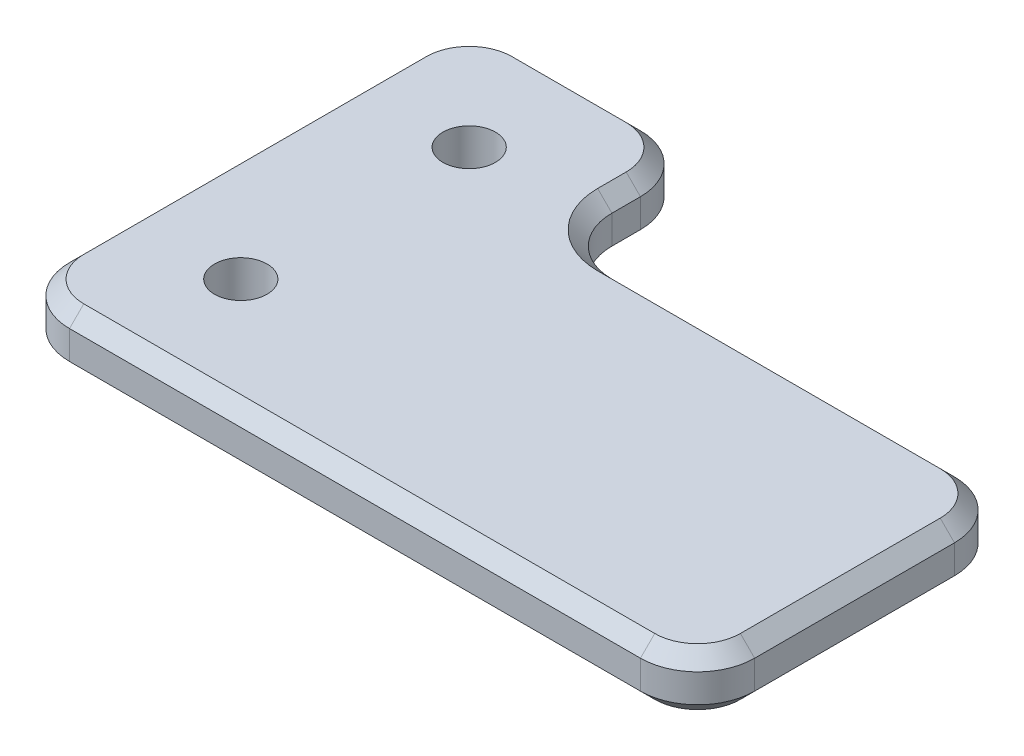
from build123d import *

# Parameters (mm, degrees)
SKETCH1_W           = 76.2
SKETCH1_H           = 6.35
BOSS_EXTRUDE1_DEPTH = 25.4
SKETCH2_R           = 2.921
CUT_EXTRUDE1_DEPTH  = 81.572467382
SKETCH3_W           = 50.8
SKETCH3_H           = 15.875
CUT_EXTRUDE2_DEPTH  = 81.572467382
FILLET1_R           = 6.35
CHAMFER2_SIZE       = 1.5875


with BuildPart() as part:
    # Sketch1 → Boss-Extrude1 (new, symmetric)
    with BuildSketch(Plane.XY):
        with Locations((38.1, 3.175)):
            Rectangle(SKETCH1_W, SKETCH1_H)
    extrude(amount=BOSS_EXTRUDE1_DEPTH, both=True)

    # Sketch2 → Cut-Extrude1 (cut, through all)
    with BuildSketch(Plane(origin=(0, 6.35, 0), x_dir=(1, 0, 0), z_dir=(0, 1, 0))):
        with Locations((12.7, 12.7)):
            Circle(SKETCH2_R)
        with Locations((12.7, -12.7)):
            Circle(SKETCH2_R)
    extrude(amount=-CUT_EXTRUDE1_DEPTH, mode=Mode.SUBTRACT)

    # Sketch3 → Cut-Extrude2 (cut, through all)
    with BuildSketch(Plane(origin=(0, 6.35, 0), x_dir=(1, 0, 0), z_dir=(0, 1, 0))):
        with Locations((50.8, 17.4625)):
            Rectangle(SKETCH3_W, SKETCH3_H)
    extrude(amount=-CUT_EXTRUDE2_DEPTH, mode=Mode.SUBTRACT)

    # Fillet1
    fillet1_edges = [part.edges().sort_by_distance(p)[0] for p in [
        (0, 3.175, 25.4),
        (0, 3.175, -25.4),
        (25.4, 3.175, -25.4),
        (25.4, 3.175, -9.525),
        (76.2, 3.175, 25.4),
        (76.2, 3.175, -9.525),
    ]]
    fillet(fillet1_edges, radius=FILLET1_R)

    # Chamfer2
    chamfer2_edges = [part.edges().sort_by_distance(p)[0] for p in [
        (1.859871939, 0, 23.540128061),
        (38.1, 0, 25.4),
        (74.340128061, 0, 23.540128061),
        (76.2, 0, 7.9375),
        (74.340128061, 0, -7.665128061),
        (50.8, 0, -9.525),
        (27.259871939, 0, -11.384871939),
        (25.4, 0, -17.4625),
        (23.540128061, 0, -23.540128061),
        (12.7, 0, -25.4),
        (0, 0, 0),
        (1.859871939, 0, -23.540128061),
        (1.859871939, 6.35, 23.540128061),
        (38.1, 6.35, 25.4),
        (74.340128061, 6.35, 23.540128061),
        (76.2, 6.35, 7.9375),
        (74.340128061, 6.35, -7.665128061),
        (50.8, 6.35, -9.525),
        (27.259871939, 6.35, -11.384871939),
        (25.4, 6.35, -17.4625),
        (23.540128061, 6.35, -23.540128061),
        (12.7, 6.35, -25.4),
        (1.859871939, 6.35, -23.540128061),
        (0, 6.35, 0),
    ]]
    chamfer(chamfer2_edges, length=CHAMFER2_SIZE)


solid = part.part
